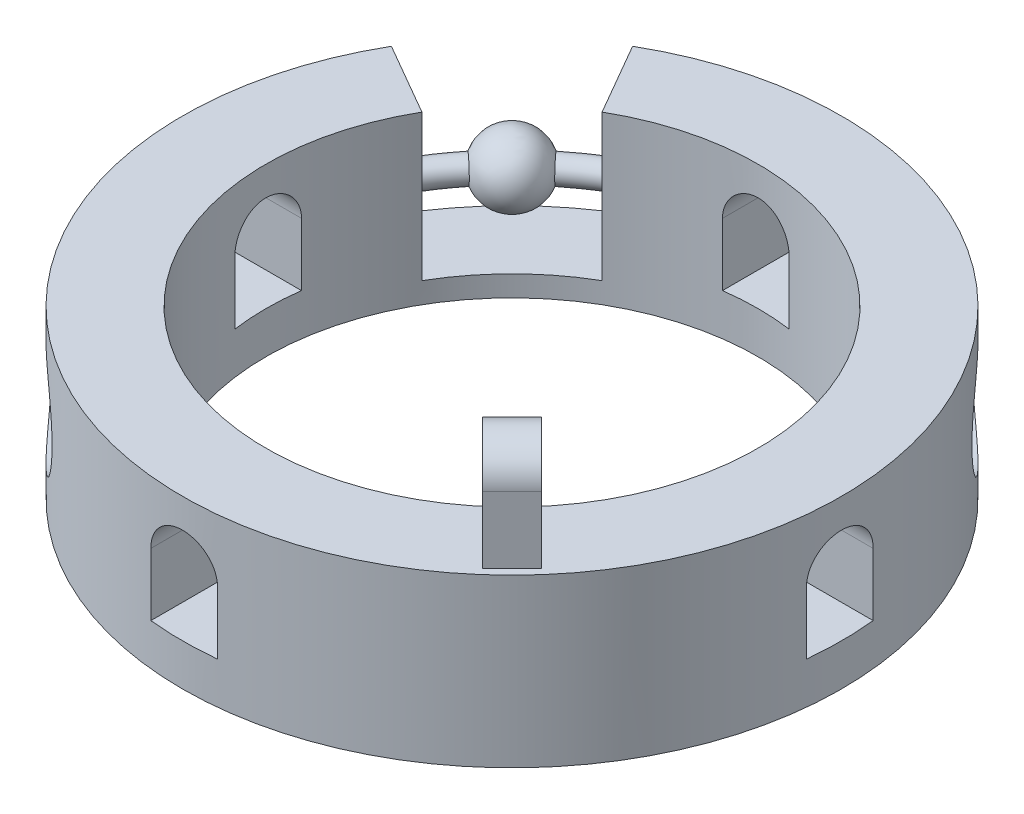
from build123d import *

# Parameters (mm, degrees)
SKETCH1_R           = 39.5
SKETCH1_R_2         = 29.5
BOSS_EXTRUDE1_DEPTH = 20
CUT_EXTRUDE1_DEPTH  = 60.333801496
CUT_EXTRUDE2_DEPTH  = 60.333801663
CUT_EXTRUDE3_REACH  = 61.334
SKETCH4_R           = 3.175
CUT_EXTRUDE4_REACH  = 61.334
SKETCH4_2_R         = 3.175
BOSS_EXTRUDE2_DEPTH = 13
CUT_EXTRUDE7_REACH  = 69.045
CUT_EXTRUDE8_REACH  = 68.559
SKETCH7_R           = 1
SKETCH8_R           = 6.35
CUT_EXTRUDE9_DEPTH  = 1
CUT_EXTRUDE11_START = -17.5
CUT_EXTRUDE11_DEPTH = 17.5
SKETCH14_R          = 1.5


with BuildPart() as part:
    # Sketch1 → Boss-Extrude1 (new body)
    with BuildSketch(Plane(origin=(0, 0, 0), x_dir=(1, 0, 0), z_dir=(0, 1, 0))):
        Circle(SKETCH1_R)
        Circle(SKETCH1_R_2, mode=Mode.SUBTRACT)
    extrude(amount=BOSS_EXTRUDE1_DEPTH)

    # Sketch2 → Cut-Extrude1 (cut, through all)
    with BuildSketch(Plane(origin=(0, 0, 0), x_dir=(0, 0, -1), z_dir=(1, 0, 0))):
        with BuildLine():
            Line((4, 5), (-4, 5))
            Line((-4, 5), (-4, 12.5))
            ThreePointArc((-4, 12.5), (0, 16.5), (4, 12.5))
            Line((4, 12.5), (4, 5))
        make_face()
    cut_extrude1 = extrude(amount=-CUT_EXTRUDE1_DEPTH, mode=Mode.SUBTRACT)

    # Sketch2<2> → Cut-Extrude2 (cut, through all)
    with BuildSketch(Plane(origin=(0, 0, 0), x_dir=(0, 0, -1), z_dir=(1, 0, 0))):
        with BuildLine():
            Line((4, 5), (-4, 5))
            Line((-4, 5), (-4, 12.5))
            ThreePointArc((-4, 12.5), (0, 16.5), (4, 12.5))
            Line((4, 12.5), (4, 5))
        make_face()
    cut_extrude2 = extrude(amount=CUT_EXTRUDE2_DEPTH, mode=Mode.SUBTRACT)

    # Mirror1: Cut-Extrude1, Cut-Extrude2 across plane
    add(cut_extrude1.mirror(Plane(origin=(0, 0, 0), x_dir=(0.7071067811865478, 0, 0.7071067811865472), z_dir=(0.7071067811865475, 0, -0.7071067811865477))), mode=Mode.SUBTRACT)
    add(cut_extrude2.mirror(Plane(origin=(0, 0, 0), x_dir=(0.7071067811865478, 0, 0.7071067811865472), z_dir=(0.7071067811865475, 0, -0.7071067811865477))), mode=Mode.SUBTRACT)

    # Sketch4 → Cut-Extrude3 (cut, up to next)
    with BuildSketch(Plane(origin=(0, 0, 0), x_dir=(-0.7071067811865477, 0, -0.7071067811865475), z_dir=(0.7071067811865475, 0, -0.7071067811865477)), mode=Mode.PRIVATE) as cut_extrude3_sk1:
        with Locations((0, 10)):
            Circle(SKETCH4_R)
    cut_extrude3_tool1 = extrude(cut_extrude3_sk1.sketch, amount=-CUT_EXTRUDE3_REACH, mode=Mode.PRIVATE) & part.part
    add(cut_extrude3_tool1.solids().sort_by_distance((0, 10, 0))[0], mode=Mode.SUBTRACT)

    # Sketch4<2> → Cut-Extrude4 (cut, up to next)
    with BuildSketch(Plane(origin=(0, 0, 0), x_dir=(-0.7071067811865477, 0, -0.7071067811865475), z_dir=(0.7071067811865475, 0, -0.7071067811865477)), mode=Mode.PRIVATE) as cut_extrude4_sk1:
        with Locations((0, 10)):
            Circle(SKETCH4_2_R)
    cut_extrude4_tool1 = extrude(cut_extrude4_sk1.sketch, amount=CUT_EXTRUDE4_REACH, mode=Mode.PRIVATE) & part.part
    add(cut_extrude4_tool1.solids().sort_by_distance((0, 10, 0))[0], mode=Mode.SUBTRACT)

    # Sketch5 → Boss-Extrude2 (add)
    with BuildSketch(Plane(origin=(0, 20, 0), x_dir=(1, 0, 0), z_dir=(0, 1, 0))):
        Polygon((25.455844123, -28.991378029), (28.991378029, -25.455844123), (23.334523779, -19.798989873), (19.798989873, -23.334523779), align=None)
    extrude(amount=BOSS_EXTRUDE2_DEPTH)

    # Sketch6 → Cut-Extrude7 (cut, up to next)
    with BuildSketch(Plane(origin=(1.767766953, 0, -1.767766953), x_dir=(-0.7071067811865475, 0, -0.7071067811865477), z_dir=(0.7071067811865477, 0, -0.7071067811865475)), mode=Mode.PRIVATE) as cut_extrude7_sk1:
        with BuildLine():
            Line((-38.5, 28), (-38.5, 33))
            Line((-38.5, 33), (-30.5, 33))
            Line((-30.5, 33), (-30.5, 28))
            ThreePointArc((-30.5, 28), (-34.5, 32), (-38.5, 28))
        make_face()
    cut_extrude7_tool1 = extrude(cut_extrude7_sk1.sketch, amount=-CUT_EXTRUDE7_REACH, mode=Mode.PRIVATE) & part.part
    add(cut_extrude7_tool1.solids().sort_by_distance((26.162951, 32.09434, 22.627417))[0], mode=Mode.SUBTRACT)

    # Sketch7 → Cut-Extrude8 (cut, up to next)
    with BuildSketch(Plane(origin=(1.767766953, 0, -1.767766953), x_dir=(-0.7071067811865475, 0, -0.7071067811865477), z_dir=(0.7071067811865477, 0, -0.7071067811865475)), mode=Mode.PRIVATE) as cut_extrude8_sk1:
        with Locations((-34.5, 28)):
            Circle(SKETCH7_R)
    cut_extrude8_tool1 = extrude(cut_extrude8_sk1.sketch, amount=-CUT_EXTRUDE8_REACH, mode=Mode.PRIVATE) & part.part
    add(cut_extrude8_tool1.solids().sort_by_distance((26.162951, 28, 22.627417))[0], mode=Mode.SUBTRACT)

    # Sketch8 → Cut-Extrude9 (cut)
    with BuildSketch(Plane(origin=(27.930717857, 0, -27.930717857), x_dir=(-0.7071067811865477, 0, -0.7071067811865475), z_dir=(0.7071067811865475, 0, -0.7071067811865477))):
        with Locations((0, 10)):
            Circle(SKETCH8_R)
    cut_extrude9 = extrude(amount=-CUT_EXTRUDE9_DEPTH, mode=Mode.SUBTRACT)

    # Mirror3: Cut-Extrude9 across plane
    add(cut_extrude9.mirror(Plane(origin=(0, 0, 0), x_dir=(0.7071067811865478, 0, 0.7071067811865472), z_dir=(0.7071067811865475, 0, -0.7071067811865477))), mode=Mode.SUBTRACT)

    # Sketch9 → Cut-Extrude11 (cut)
    with BuildSketch(Plane(origin=(0, 20, 0), x_dir=(1, 0, 0), z_dir=(0, 1, 0)).offset(CUT_EXTRUDE11_START)):
        with BuildLine():
            Line((-14.75, 25.547749412), (-19.75, 34.208003449))
            ThreePointArc((-19.75, 34.208003449), (-27.930717857, 27.930717857), (-34.208003449, 19.75))
            Line((-34.208003449, 19.75), (-25.547749412, 14.75))
            ThreePointArc((-25.547749412, 14.75), (-20.859650045, 20.859650045), (-14.75, 25.547749412))
        make_face()
    extrude(amount=CUT_EXTRUDE11_DEPTH, mode=Mode.SUBTRACT)



with BuildPart() as body_2:
    # Sketch10 → Revolve2 (revolve)
    with BuildSketch(Plane(origin=(0, 0, 0), x_dir=(-0.7071067811865477, 0, -0.7071067811865475), z_dir=(0.7071067811865475, 0, -0.7071067811865477))):
        with BuildLine():
            Line((30.5, 10), (38.5, 10))
            ThreePointArc((38.5, 10), (34.5, 14), (30.5, 10))
        make_face()
    revolve(axis=Axis((-41.250230194, 10, -41.250230194), (0.7071067811865477, 0, 0.7071067811865475)))


with BuildPart() as part_1:
    add(part.part)

    add(body_2.part)  # Sweep1 merges body 2
    # Sweep1: sweep along a path in Sketch12
    with BuildLine(Plane(origin=(0, 10, 0), x_dir=(1, 0, 0), z_dir=(0, 1, 0))) as sweep1_path:
        ThreePointArc((-14.579362797, 31.268069663), (-24.267687928, 24.522017099), (-31.114377024, 14.904547709))
    # Sketch14 → Sweep1 (sweep)
    with BuildSketch(Plane(origin=(0, 0, 0), x_dir=(-0.7071067811865477, 0, -0.7071067811865475), z_dir=(0.7071067811865475, 0, -0.7071067811865477))):
        with Locations((34.5, 10)):
            Circle(SKETCH14_R)
    sweep(path=sweep1_path.line)


solid = part_1.part
